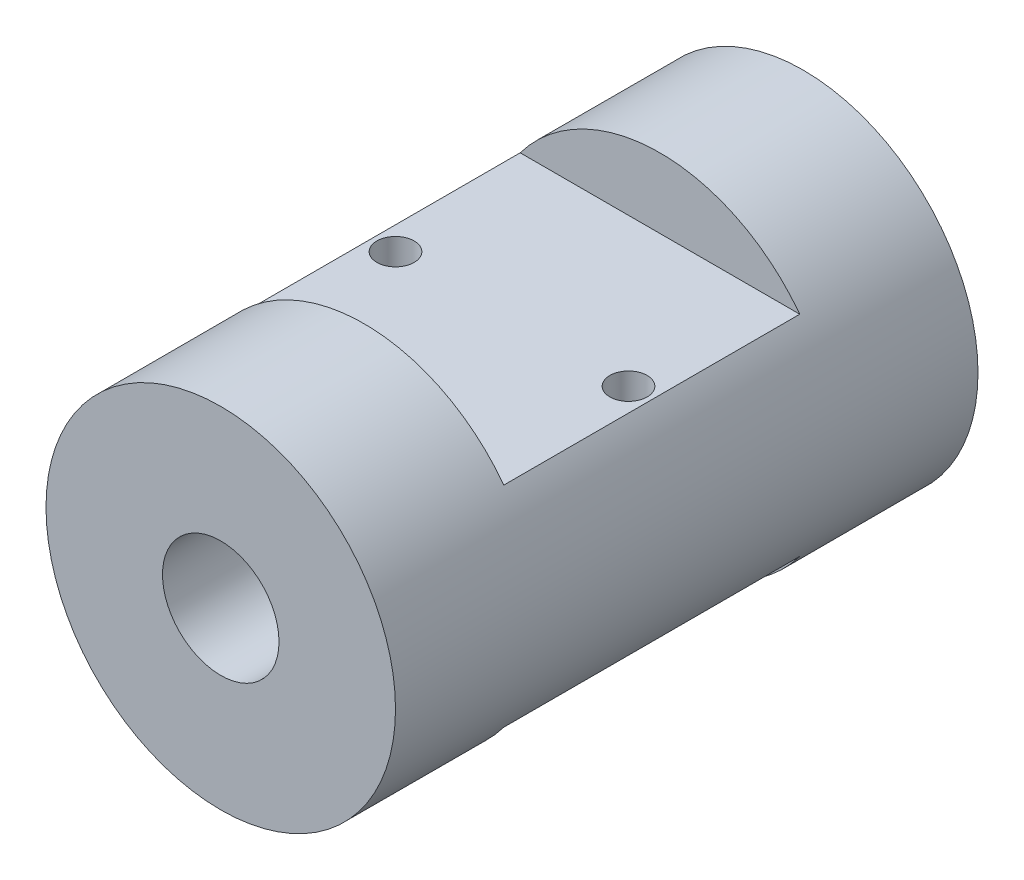
from build123d import *

# Parameters (mm, degrees)
SKETCH1_W               = 10
SKETCH1_H               = 50
CUT_EXTRUDE1_DEPTH      = 12.7
CUT_EXTRUDE1_DEPTH_BACK = 12.7
SKETCH2_W               = 30
SKETCH2_H               = 6
SKETCH3_W               = 1.6
SKETCH3_H               = 18
SKETCH3_3_W             = 1.6
SKETCH3_3_H             = 18


with BuildPart() as part:
    # Sketch1 → Revolve1 (revolve)
    with BuildSketch(Plane(origin=(0, 0, 0), x_dir=(1, 0, 0), z_dir=(0, 1, 0))):
        with Locations((10, 0)):
            Rectangle(SKETCH1_W, SKETCH1_H)
    revolve(axis=Axis((0, 0, 25), (0, 0, -1)))

    # Sketch2 → Cut-Extrude1 (cut, two sides: drawn at the far end of the back side and taken through both)
    with BuildSketch(Plane.XY.offset(-CUT_EXTRUDE1_DEPTH_BACK)):
        with Locations((0, 12)):
            Rectangle(SKETCH2_W, SKETCH2_H)
        with Locations((0, -12)):
            Rectangle(SKETCH2_W, SKETCH2_H)
    extrude(amount=CUT_EXTRUDE1_DEPTH + CUT_EXTRUDE1_DEPTH_BACK, mode=Mode.SUBTRACT)

    # Sketch3 → Cut-Revolve1 (revolve, cut)
    with BuildSketch(Plane.XY):
        with Locations((9.2, 0)):
            Rectangle(SKETCH3_W, SKETCH3_H)
    revolve(axis=Axis((10, -9, 0), (0, -1, 0)), mode=Mode.SUBTRACT)

    # Sketch3<3> → Cut-Revolve2 (revolve, cut)
    with BuildSketch(Plane.XY):
        with Locations((-9.2, 0)):
            Rectangle(SKETCH3_3_W, SKETCH3_3_H)
    revolve(axis=Axis((-10, -9, 0), (0, -1, 0)), mode=Mode.SUBTRACT)


solid = part.part
